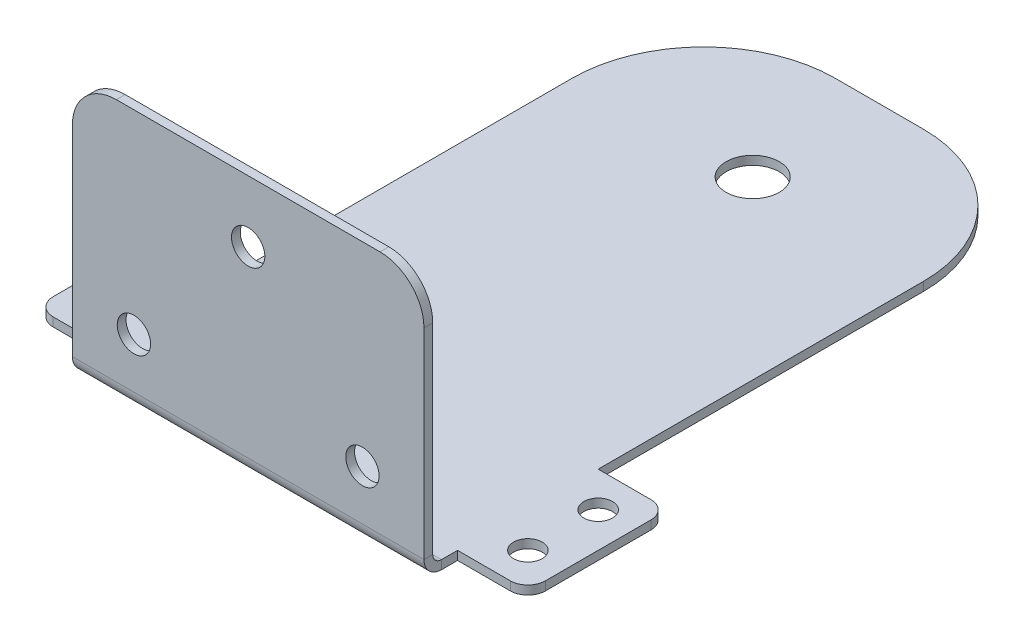
from build123d import *

# Parameters (mm, degrees)
BASE_FLANGE1_DEPTH       = 1
SKETCHED_START           = 21.616422755
SKETCHED_BEND1_OUTLINE_W = 40
SKETCHED_BEND1_OUTLINE_H = 1
SKETCHED_BEND1_DEPTH     = 28.383577245
SKETCHED_START_2         = 20.821902755
SKETCHED_BEND1_2_DEPTH   = 0.00548
SKETCHED_START_3         = 19.821902755
SKETCHED_BEND1_3_DEPTH   = 2
SKETCHED_START_4         = -20
SKETCHED_BEND1_4_DEPTH   = 40
SKETCH7_R                = 3.025
CUT_EXTRUDE1_DEPTH       = 10
F_6_CLEARANCE_HOLE1_D    = 3.7973
F_4_CLEARANCE_HOLE2_D    = 3.2639


with BuildPart() as part:
    # Base-Flange1: sheet metal written as solids
    # Sketch1 → Base-Flange1 (new body)
    with BuildSketch(Plane(origin=(0, 0, 0), x_dir=(1, 0, 0), z_dir=(0, 1, 0))):
        with BuildLine():
            Line((-20, -18), (-20, -45))
            ThreePointArc((-20, -45), (-18.535533906, -48.535533906), (-15, -50))
            Line((-15, -50), (15, -50))
            ThreePointArc((15, -50), (18.535533906, -48.535533906), (20, -45))
            Line((20, -45), (20, -18))
            Line((20, -18), (26, -18))
            ThreePointArc((26, -18), (27.414213562, -17.414213562), (28, -16))
            Line((28, -16), (28, -4))
            ThreePointArc((28, -4), (27.414213562, -2.585786438), (26, -2))
            Line((26, -2), (20, -2))
            Line((20, -2), (20, 35))
            ThreePointArc((20, 35), (15.606601718, 45.606601718), (5, 50))
            Line((5, 50), (-5, 50))
            ThreePointArc((-5, 50), (-15.606601718, 45.606601718), (-20, 35))
            Line((-20, 35), (-20, -2))
            Line((-20, -2), (-26, -2))
            ThreePointArc((-26, -2), (-27.414213562, -2.585786438), (-28, -4))
            Line((-28, -4), (-28, -16))
            ThreePointArc((-28, -16), (-27.414213562, -17.414213562), (-26, -18))
            Line((-26, -18), (-20, -18))
        make_face()
    extrude(amount=-BASE_FLANGE1_DEPTH)

    # Sketched Bend1: read off the stored shape, not the designer's step
    # Sketched Bend1 outline → Sketched Bend1 (cut)
    with BuildSketch(Plane.XY.offset(SKETCHED_START)):
        with Locations((0, -0.5)):
            Rectangle(SKETCHED_BEND1_OUTLINE_W, SKETCHED_BEND1_OUTLINE_H)
    extrude(amount=SKETCHED_BEND1_DEPTH, mode=Mode.SUBTRACT)

    # Sketched Bend1 2 outline → Sketched Bend1 2 (add)
    with BuildSketch(Plane.XY.offset(SKETCHED_START_2)):
        with BuildLine():
            Line((20, 0), (20, 23.821902755))
            ThreePointArc((20, 23.821902755), (18.535533906, 27.357436661), (15, 28.821902755))
            Line((15, 28.821902755), (-15, 28.821902755))
            ThreePointArc((-15, 28.821902755), (-18.535533906, 27.357436661), (-20, 23.821902755))
            Line((-20, 23.821902755), (-20, 0))
            Line((-20, 0), (20, 0))
        make_face()
    extrude(amount=SKETCHED_BEND1_2_DEPTH)

    # Sketched Bend1 3 outline → Sketched Bend1 3 (add)
    with BuildSketch(Plane.XY.offset(SKETCHED_START_3)):
        with BuildLine():
            Line((20, 0), (20, 23.821902755))
            ThreePointArc((20, 23.821902755), (18.535533906, 27.357436661), (15, 28.821902755))
            Line((15, 28.821902755), (-15, 28.821902755))
            ThreePointArc((-15, 28.821902755), (-18.535533906, 27.357436661), (-20, 23.821902755))
            Line((-20, 23.821902755), (-20, 0))
            Line((-20, 0), (20, 0))
        make_face()
    extrude(amount=SKETCHED_BEND1_3_DEPTH)

    # Sketched Bend1 4 outline → Sketched Bend1 4 (cut)
    with BuildSketch(Plane.YZ.offset(SKETCHED_START_4)):
        with BuildLine():
            Line((28.821902755, 19.821902755), (28.821902755, 20.821902755))
            Line((28.821902755, 20.821902755), (1, 20.821902755))
            ThreePointArc((1, 20.821902755), (0.292893219, 20.529009536), (0, 19.821902755))
            Line((0, 19.821902755), (28.821902755, 19.821902755))
        make_face()
        with BuildLine():
            ThreePointArc((-1, 19.821902755), (-0.414213562, 21.236116317), (1, 21.821902755))
            Line((1, 21.821902755), (0, 21.821902755))
            Line((0, 21.821902755), (0, 21.616422755))
            Line((0, 21.616422755), (-1, 21.616422755))
            Line((-1, 21.616422755), (-1, 19.821902755))
        make_face()
    extrude(amount=SKETCHED_BEND1_4_DEPTH, mode=Mode.SUBTRACT)

    # Sketch7 → Cut-Extrude1 (cut)
    with BuildSketch(Plane(origin=(0, 0, 0), x_dir=(1, 0, 0), z_dir=(0, 1, 0))):
        with Locations(Location((0, -6.821902755, 0), (0, 0, 270))):
            Circle(SKETCH7_R)
        with Locations(Location((0, 35.578097245, 0), (0, 0, 270))):
            Circle(SKETCH7_R)
    extrude(amount=-CUT_EXTRUDE1_DEPTH, mode=Mode.SUBTRACT)

    # #6 Clearance Hole1 (through all)
    with Locations(Plane(origin=(0, 0, 20.821902755), x_dir=(-1, 0, 0), z_dir=(0, 0, -1))):
        with Locations((13, 6.681902755), (-13, 6.681902755), (0, 21.821902755)):
            Hole(F_6_CLEARANCE_HOLE1_D / 2)

    # #4 Clearance Hole2 (through all)
    with Locations(Plane(origin=(0, 0, 0), x_dir=(1, 0, 0), z_dir=(0, 1, 0))):
        with Locations((-24, -6), (-24, -14), (24, -6), (24, -14)):
            Hole(F_4_CLEARANCE_HOLE2_D / 2)


solid = part.part
